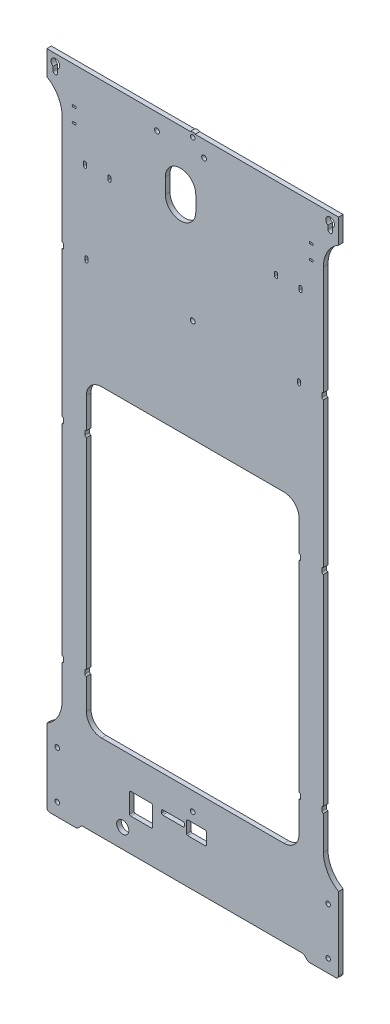
from build123d import *

# Parameters (mm, degrees)
SKETCH1_R           = 1.5
BOSS_EXTRUDE1_DEPTH = 3
SKETCH2_W           = 10
SKETCH2_H           = 368
CUT_EXTRUDE1_DEPTH  = 407.004798494
FILLET1_R           = 20
SKETCH3_R           = 1.5
CUT_EXTRUDE2_DEPTH  = 407.004798494
SKETCH4_W           = 139.84
SKETCH4_H           = 200
CUT_EXTRUDE3_DEPTH  = 407.004798494
FILLET2_R           = 10
SKETCH5_W           = 15
SKETCH5_H           = 14.1
SKETCH5_H_2         = 3
SKETCH5_W_2         = 13
SKETCH5_H_3         = 9
CUT_EXTRUDE4_DEPTH  = 407.004798494
FILLET3_R           = 0.8
SKETCH6_R           = 4
CUT_EXTRUDE5_DEPTH  = 407.004798494
SKETCH8_R           = 1.6
CUT_EXTRUDE7_DEPTH  = 407.004798494
BOSS_EXTRUDE2_DEPTH = 3
CUT_EXTRUDE8_DEPTH  = 407.490647371
CUT_EXTRUDE9_DEPTH  = 407.490647371
FILLET5_R           = 2


with BuildPart() as part:
    # Sketch1 → Boss-Extrude1 (new body)
    with BuildSketch(Plane.XY):
        Polygon((95.92, 394.5), (-95.92, 394.5), (-95.92, -36.5), (-95.92, -39.5), (-75.92, -39.5), (-72.92, -36.5), (72.92, -36.5), (75.92, -39.5), (95.92, -39.5), (95.92, -36.5), align=None)
        with Locations((89.02, -31)):
            Circle(SKETCH1_R, mode=Mode.SUBTRACT)
        with BuildLine():
            Line((88.82, 384), (88.82, 386.423324163))
            ThreePointArc((88.82, 386.423324163), (90.32, 391.696648326), (91.82, 386.423324163))
            Line((91.82, 386.423324163), (91.82, 384))
            ThreePointArc((91.82, 384), (90.32, 382.5), (88.82, 384))
        make_face(mode=Mode.SUBTRACT)
        with BuildLine():
            Line((-91.82, 384), (-91.82, 386.423324163))
            ThreePointArc((-91.82, 386.423324163), (-90.32, 391.696648326), (-88.82, 386.423324163))
            Line((-88.82, 386.423324163), (-88.82, 384))
            ThreePointArc((-88.82, 384), (-90.32, 382.5), (-91.82, 384))
        make_face(mode=Mode.SUBTRACT)
        with BuildLine():
            ThreePointArc((-90.52, 0), (-89.02, -1.5), (-87.52, 0))
            ThreePointArc((-87.52, 0), (-89.02, 1.5), (-90.52, 0))
        make_face(mode=Mode.SUBTRACT)
        with BuildLine():
            ThreePointArc((87.52, 0), (89.02, -1.5), (90.52, 0))
            ThreePointArc((90.52, 0), (89.02, 1.5), (87.52, 0))
        make_face(mode=Mode.SUBTRACT)
        with BuildLine():
            ThreePointArc((-90.52, -31), (-89.02, -32.5), (-87.52, -31))
            ThreePointArc((-87.52, -31), (-89.02, -29.5), (-90.52, -31))
        make_face(mode=Mode.SUBTRACT)
    extrude(amount=BOSS_EXTRUDE1_DEPTH)

    # Sketch2 → Cut-Extrude1 (cut, through all)
    with BuildSketch(Plane.XY.offset(3)):
        with Locations((-90.92, 194.5)):
            Rectangle(SKETCH2_W, SKETCH2_H)
        with Locations((90.92, 194.5)):
            Rectangle(SKETCH2_W, SKETCH2_H)
    extrude(amount=-CUT_EXTRUDE1_DEPTH, mode=Mode.SUBTRACT)

    # Fillet1
    # the kernel refuses this fillet: 20 mm, written as the material it adds along each edge
    with BuildSketch(Plane(origin=(85.92, 10.5, 3), x_dir=(0, 1, 0), z_dir=(0, 0, -1))) as fillet1_piece_1:
        with BuildLine():
            CenterArc((17.320508076, 20), FILLET1_R, 210, 60)
            Line((0, 10), (-0.346410162, 9.8))
            ThreePointArc((-0.346410162, 9.8), (-0.4, 5), (-0.4, 0))
            Line((-0.4, 0), (0, -0.4))
            Line((0, -0.4), (17.320508076, -0.4))
            Line((17.320508076, -0.4), (17.320508076, 0))
        make_face()
    extrude(amount=3)
    with BuildSketch(Plane(origin=(-85.92, 10.5, 3), x_dir=(-1, 0, 0), z_dir=(0, 0, -1)), Plane(origin=(85.92, 378.5, 3), x_dir=(1, 0, 0), z_dir=(0, 0, -1))) as fillet1_piece_2:
        with BuildLine():
            CenterArc((20, 17.320508076), FILLET1_R, 180, 60)
            Line((0, 17.320508076), (-0.4, 17.320508076))
            Line((-0.4, 17.320508076), (-0.4, 0))
            Line((-0.4, 0), (0, -0.4))
            ThreePointArc((0, -0.4), (5, -0.4), (9.8, -0.346410162))
            Line((9.8, -0.346410162), (10, 0))
        make_face()
    extrude(amount=3)
    with BuildSketch(Plane(origin=(-85.92, 378.5, 3), x_dir=(-1, 0, 0), z_dir=(0, 0, -1))) as fillet1_piece_3:
        with BuildLine():
            CenterArc((20, -17.320508076), FILLET1_R, 120, 60)
            Line((0, -17.320508076), (-0.4, -17.320508076))
            Line((-0.4, -17.320508076), (-0.4, 0))
            Line((-0.4, 0), (0, 0.4))
            ThreePointArc((0, 0.4), (5, 0.4), (9.8, 0.346410162))
            Line((9.8, 0.346410162), (10, 0))
        make_face()
    extrude(amount=3)

    # Sketch3 → Cut-Extrude2 (cut, through all)
    with BuildSketch(Plane.XY.offset(3)):
        with Locations((0, 8)):
            Circle(SKETCH3_R)
        with Locations((0, 392)):
            Circle(SKETCH3_R)
    extrude(amount=-CUT_EXTRUDE2_DEPTH, mode=Mode.SUBTRACT)

    # Sketch4 → Cut-Extrude3 (cut, through all)
    with BuildSketch(Plane.XY.offset(3)):
        with Locations((0, 120)):
            Rectangle(SKETCH4_W, SKETCH4_H)
    extrude(amount=-CUT_EXTRUDE3_DEPTH, mode=Mode.SUBTRACT)

    # Fillet2
    fillet2_edges = [part.edges().sort_by_distance(p)[0] for p in [
        (69.92, 220, 1.5),
        (69.92, 20, 1.5),
        (-69.92, 20, 1.5),
        (-69.92, 220, 1.5),
    ]]
    fillet(fillet2_edges, radius=FILLET2_R)

    # Sketch5 → Cut-Extrude4 (cut, through all)
    with BuildSketch(Plane.XY.offset(3)):
        with Locations((-34, -7.85)):
            Rectangle(SKETCH5_W, SKETCH5_H)
        with Locations((-13, -2.3)):
            Rectangle(SKETCH5_W, SKETCH5_H_2)
        with Locations((2.5, -2.8)):
            Rectangle(SKETCH5_W_2, SKETCH5_H_3)
    extrude(amount=-CUT_EXTRUDE4_DEPTH, mode=Mode.SUBTRACT)

    # Fillet3
    fillet3_edges = [part.edges().sort_by_distance(p)[0] for p in [
        (-41.5, -14.9, 1.5),
        (-41.5, -0.8, 1.5),
        (-26.5, -0.8, 1.5),
        (-26.5, -14.9, 1.5),
        (-20.5, -3.8, 1.5),
        (-20.5, -0.8, 1.5),
        (-5.5, -0.8, 1.5),
        (-5.5, -3.8, 1.5),
        (-4, -7.3, 1.5),
        (-4, 1.7, 1.5),
        (9, 1.7, 1.5),
        (9, -7.3, 1.5),
    ]]
    fillet(fillet3_edges, radius=FILLET3_R)

    # Sketch6 → Cut-Extrude5 (cut, through all)
    with BuildSketch(Plane.XY.offset(3)):
        with Locations((-46, -23.8)):
            Circle(SKETCH6_R)
    extrude(amount=-CUT_EXTRUDE5_DEPTH, mode=Mode.SUBTRACT)

    # Sketch8 → Cut-Extrude7 (cut, through all)
    with BuildSketch(Plane.XY.offset(3)):
        with Locations((0, 287.5)):
            Circle(SKETCH8_R)
        with Locations((7.5, 383.9)):
            Circle(SKETCH8_R)
        with Locations((-23.5, 383.9)):
            Circle(SKETCH8_R)
        with BuildLine():
            Line((-18, 350.4), (-18, 360.4))
            ThreePointArc((-18, 360.4), (-8, 370.4), (2, 360.4))
            Line((2, 360.4), (2, 350.4))
            ThreePointArc((2, 350.4), (-8, 340.4), (-18, 350.4))
        make_face()
    extrude(amount=-CUT_EXTRUDE7_DEPTH, mode=Mode.SUBTRACT)

    # Sketch9 → Boss-Extrude2 (add)
    with BuildSketch(Plane.XY.offset(3)):
        with BuildLine():
            Line((-1.658312395, 394.5), (1.658312395, 394.5))
            ThreePointArc((1.658312395, 394.5), (0, 395), (-1.658312395, 394.5))
        make_face()
    extrude(amount=-BOSS_EXTRUDE2_DEPTH)

    # Sketch10 → Cut-Extrude8 (cut, through all)
    with BuildSketch(Plane.XY.offset(3)):
        with BuildLine():
            Line((-78.57, 371.15), (-77.27, 371.15))
            ThreePointArc((-77.27, 371.15), (-76.62, 370.5), (-77.27, 369.85))
            Line((-77.27, 369.85), (-78.57, 369.85))
            ThreePointArc((-78.57, 369.85), (-79.22, 370.5), (-78.57, 371.15))
        make_face()
        with BuildLine():
            Line((-78.57, 361.65), (-77.27, 361.65))
            ThreePointArc((-77.27, 361.65), (-76.62, 361), (-77.27, 360.35))
            Line((-77.27, 360.35), (-78.57, 360.35))
            ThreePointArc((-78.57, 360.35), (-79.22, 361), (-78.57, 361.65))
        make_face()
        with BuildLine():
            Line((77.27, 371.15), (78.57, 371.15))
            ThreePointArc((78.57, 371.15), (79.22, 370.5), (78.57, 369.85))
            Line((78.57, 369.85), (77.27, 369.85))
            ThreePointArc((77.27, 369.85), (76.62, 370.5), (77.27, 371.15))
        make_face()
        with BuildLine():
            Line((77.27, 361.65), (78.57, 361.65))
            ThreePointArc((78.57, 361.65), (79.22, 361), (78.57, 360.35))
            Line((78.57, 360.35), (77.27, 360.35))
            ThreePointArc((77.27, 360.35), (76.62, 361), (77.27, 361.65))
        make_face()
    extrude(amount=-CUT_EXTRUDE8_DEPTH, mode=Mode.SUBTRACT)

    # Sketch11 → Cut-Extrude9 (cut, through all)
    with BuildSketch(Plane.XY.offset(3)):
        with BuildLine():
            Line((86.92, 189), (86.92, 187))
            ThreePointArc((86.92, 187), (85.92, 186), (84.92, 187))
            Line((84.92, 187), (84.92, 189))
            ThreePointArc((84.92, 189), (85.92, 190), (86.92, 189))
        make_face()
        with BuildLine():
            Line((70.92, 189), (70.92, 187))
            ThreePointArc((70.92, 187), (69.92, 186), (68.92, 187))
            Line((68.92, 187), (68.92, 189))
            ThreePointArc((68.92, 189), (69.92, 190), (70.92, 189))
        make_face()
        with BuildLine():
            Line((86.92, 288.5), (86.92, 286.5))
            ThreePointArc((86.92, 286.5), (85.92, 285.5), (84.92, 286.5))
            Line((84.92, 286.5), (84.92, 288.5))
            ThreePointArc((84.92, 288.5), (85.92, 289.5), (86.92, 288.5))
        make_face()
        with BuildLine():
            Line((70.92, 288.5), (70.92, 286.5))
            ThreePointArc((70.92, 286.5), (69.92, 285.5), (68.92, 286.5))
            Line((68.92, 286.5), (68.92, 288.5))
            ThreePointArc((68.92, 288.5), (69.92, 289.5), (70.92, 288.5))
        make_face()
        with BuildLine():
            Line((86.92, 53), (86.92, 51))
            ThreePointArc((86.92, 51), (85.92, 50), (84.92, 51))
            Line((84.92, 51), (84.92, 53))
            ThreePointArc((84.92, 53), (85.92, 54), (86.92, 53))
        make_face()
        with BuildLine():
            Line((70.92, 53), (70.92, 51))
            ThreePointArc((70.92, 51), (69.92, 50), (68.92, 51))
            Line((68.92, 51), (68.92, 53))
            ThreePointArc((68.92, 53), (69.92, 54), (70.92, 53))
        make_face()
        with BuildLine():
            Line((-86.92, 53), (-86.92, 51))
            ThreePointArc((-86.92, 51), (-85.92, 50), (-84.92, 51))
            Line((-84.92, 51), (-84.92, 53))
            ThreePointArc((-84.92, 53), (-85.92, 54), (-86.92, 53))
        make_face()
        with BuildLine():
            Line((-70.92, 53), (-70.92, 51))
            ThreePointArc((-70.92, 51), (-69.92, 50), (-68.92, 51))
            Line((-68.92, 51), (-68.92, 53))
            ThreePointArc((-68.92, 53), (-69.92, 54), (-70.92, 53))
        make_face()
        with BuildLine():
            Line((-86.92, 189), (-86.92, 187))
            ThreePointArc((-86.92, 187), (-85.92, 186), (-84.92, 187))
            Line((-84.92, 187), (-84.92, 189))
            ThreePointArc((-84.92, 189), (-85.92, 190), (-86.92, 189))
        make_face()
        with BuildLine():
            Line((-70.92, 189), (-70.92, 187))
            ThreePointArc((-70.92, 187), (-69.92, 186), (-68.92, 187))
            Line((-68.92, 187), (-68.92, 189))
            ThreePointArc((-68.92, 189), (-69.92, 190), (-70.92, 189))
        make_face()
        with BuildLine():
            Line((-86.92, 288.5), (-86.92, 286.5))
            ThreePointArc((-86.92, 286.5), (-85.92, 285.5), (-84.92, 286.5))
            Line((-84.92, 286.5), (-84.92, 288.5))
            ThreePointArc((-84.92, 288.5), (-85.92, 289.5), (-86.92, 288.5))
        make_face()
        with BuildLine():
            Line((-70.92, 288.5), (-70.92, 286.5))
            ThreePointArc((-70.92, 286.5), (-69.92, 285.5), (-68.92, 286.5))
            Line((-68.92, 286.5), (-68.92, 288.5))
            ThreePointArc((-68.92, 288.5), (-69.92, 289.5), (-70.92, 288.5))
        make_face()
        with BuildLine():
            Line((71.812712526, 342), (71.812712526, 340))
            ThreePointArc((71.812712526, 340), (70.812712526, 339), (69.812712526, 340))
            Line((69.812712526, 340), (69.812712526, 342))
            ThreePointArc((69.812712526, 342), (70.812712526, 343), (71.812712526, 342))
        make_face()
        with BuildLine():
            Line((55.812712526, 342), (55.812712526, 340))
            ThreePointArc((55.812712526, 340), (54.812712526, 339), (53.812712526, 340))
            Line((53.812712526, 340), (53.812712526, 342))
            ThreePointArc((53.812712526, 342), (54.812712526, 343), (55.812712526, 342))
        make_face()
        with BuildLine():
            Line((-71.812712526, 342), (-71.812712526, 340))
            ThreePointArc((-71.812712526, 340), (-70.812712526, 339), (-69.812712526, 340))
            Line((-69.812712526, 340), (-69.812712526, 342))
            ThreePointArc((-69.812712526, 342), (-70.812712526, 343), (-71.812712526, 342))
        make_face()
        with BuildLine():
            Line((-55.812712526, 342), (-55.812712526, 340))
            ThreePointArc((-55.812712526, 340), (-54.812712526, 339), (-53.812712526, 340))
            Line((-53.812712526, 340), (-53.812712526, 342))
            ThreePointArc((-53.812712526, 342), (-54.812712526, 343), (-55.812712526, 342))
        make_face()
    extrude(amount=-CUT_EXTRUDE9_DEPTH, mode=Mode.SUBTRACT)

    # Fillet5
    fillet5_edges = [part.edges().sort_by_distance(p)[0] for p in [
        (95.92, -39.5, 1.5),
        (75.92, -39.5, 1.5),
        (72.92, -36.5, 1.5),
        (-72.92, -36.5, 1.5),
        (-75.92, -39.5, 1.5),
        (-95.92, -39.5, 1.5),
    ]]
    fillet(fillet5_edges, radius=FILLET5_R)


solid = part.part
